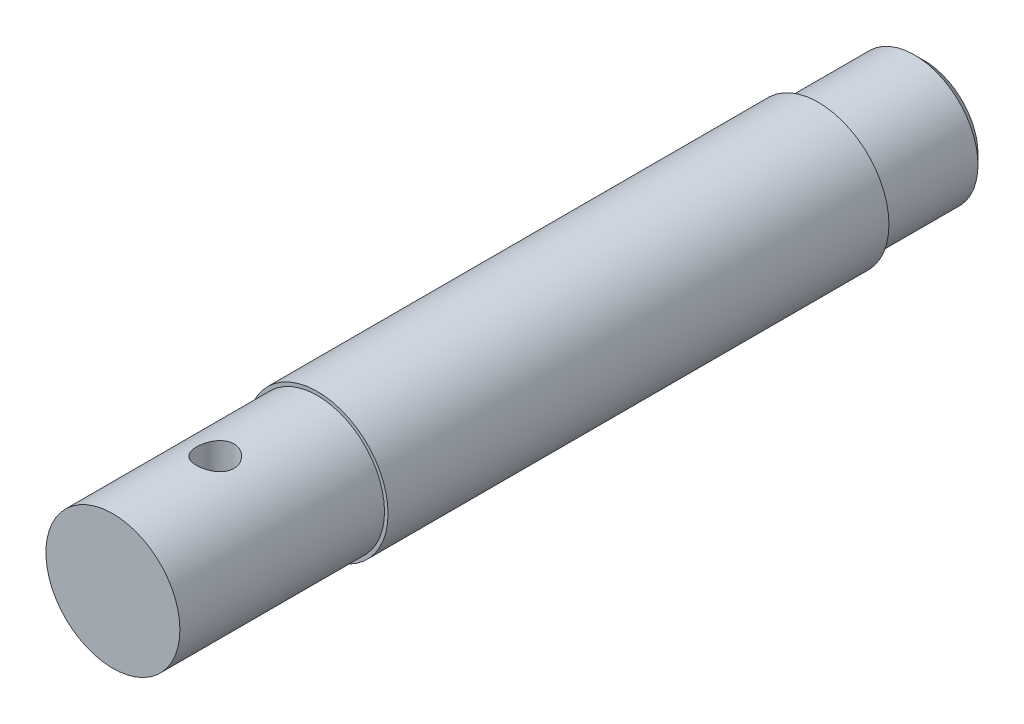
from build123d import *

# Parameters (mm, degrees)
SKETCH1_R           = 10
BOSS_EXTRUDE1_DEPTH = 57.5
SKETCH7_R           = 10
SKETCH7_R_2         = 9.5
CUT_EXTRUDE1_DEPTH  = 29
SKETCH10_W          = 2.65
SKETCH10_H          = 10


# Read off the part's stored shape, not the designer's step: M18x2.5 Machine Threads Stud1
with BuildPart() as part:
    # Sketch1 → Boss-Extrude1 (new, symmetric)
    with BuildSketch(Plane.XY):
        Circle(SKETCH1_R)
    extrude(amount=BOSS_EXTRUDE1_DEPTH, both=True)

    # M18x2.5 Machine Threads Stud1 outline → M18x2.5 Machine Threads Stud1 (revolve, cut)
    with BuildSketch(Plane.XZ):
        Polygon((7.626, -57.5), (10, -57.5), (10, -42.5), (9, -42.5), (9, -56.126), align=None)
    revolve(axis=Axis((0, 0, 0), (0, 0, 1)), mode=Mode.SUBTRACT)

    # Sketch7 → Cut-Extrude1 (cut)
    with BuildSketch(Plane.XY.offset(57.5)):
        Circle(SKETCH7_R)
        Circle(SKETCH7_R_2, mode=Mode.SUBTRACT)
    extrude(amount=-CUT_EXTRUDE1_DEPTH, mode=Mode.SUBTRACT)

    # Sketch10 → M5 Clearance Hole1 (revolve, cut)
    with BuildSketch(Plane(origin=(0, 0, 43), x_dir=(0, 0, -1), z_dir=(1, 0, 0))):
        with Locations((1.325, 5)):
            Rectangle(SKETCH10_W, SKETCH10_H)
    m5_clearance_hole1 = revolve(axis=Axis((0, -6.35, 43), (0, 1, 0)), mode=Mode.SUBTRACT)

    # Mirror2: M5 Clearance Hole1 across plane
    add(m5_clearance_hole1.mirror(Plane.ZX), mode=Mode.SUBTRACT)


solid = part.part
